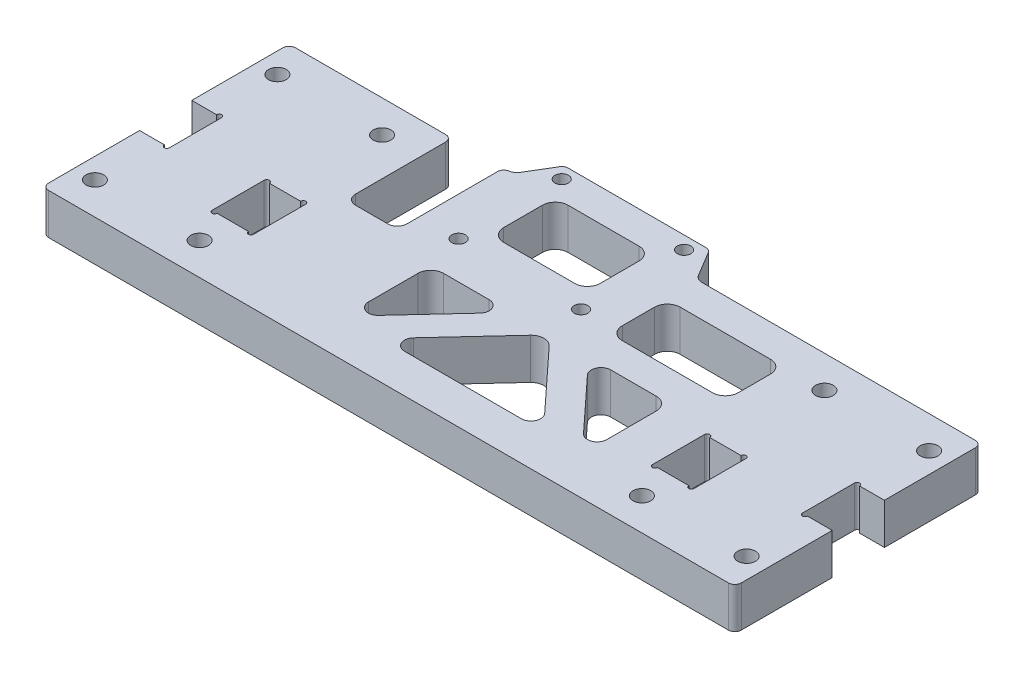
from build123d import *

# Parameters (mm, degrees)
SKETCH1_R           = 2.75
BOSS_EXTRUDE1_DEPTH = 12.7
SKETCH2_W           = 16
SKETCH2_H           = 41.596113018
CUT_EXTRUDE1_DEPTH  = 233.151916856
SKETCH3_R           = 2.1
CUT_EXTRUDE2_DEPTH  = 233.151916856
CUT_EXTRUDE3_DEPTH  = 233.151916856
FILLET1_R           = 3
FILLET2_R           = 2


with BuildPart() as part:
    # Sketch1 → Boss-Extrude1 (new body)
    with BuildSketch(Plane(origin=(0, 0, 0), x_dir=(1, 0, 0), z_dir=(0, 1, 0))):
        with BuildLine():
            Line((0, 0), (215, 0))
            Line((215, 0), (215, 30.225))
            Line((215, 30.225), (207.32, 30.225))
            ThreePointArc((207.32, 30.225), (206.52, 29.425), (205.72, 30.225))
            Line((205.72, 30.225), (205.72, 46.425))
            ThreePointArc((205.72, 46.425), (206.52, 47.225), (207.32, 46.425))
            Line((207.32, 46.425), (215, 46.425))
            Line((215, 46.425), (215, 76.65))
            Line((215, 76.65), (126.5, 76.65))
            Line((126.5, 76.65), (120.5, 86.65))
            Line((120.5, 86.65), (75.5, 86.65))
            Line((75.5, 86.65), (69.5, 76.65))
            Line((69.5, 76.65), (0, 76.65))
            Line((0, 76.65), (0, 46.425))
            Line((0, 46.425), (7.68, 46.425))
            ThreePointArc((7.68, 46.425), (8.48, 47.225), (9.28, 46.425))
            Line((9.28, 46.425), (9.28, 30.225))
            ThreePointArc((9.28, 30.225), (8.48, 29.425), (7.68, 30.225))
            Line((7.68, 30.225), (0, 30.225))
            Line((0, 30.225), (0, 0))
        make_face()
        with Locations((38.85, 66.65)):
            Circle(SKETCH1_R, mode=Mode.SUBTRACT)
        with Locations((38.85, 10)):
            Circle(SKETCH1_R, mode=Mode.SUBTRACT)
        with Locations((176.15, 66.65)):
            Circle(SKETCH1_R, mode=Mode.SUBTRACT)
        with Locations((176.15, 10)):
            Circle(SKETCH1_R, mode=Mode.SUBTRACT)
        with Locations((6.35, 10)):
            Circle(SKETCH1_R, mode=Mode.SUBTRACT)
        with Locations((6.35, 66.65)):
            Circle(SKETCH1_R, mode=Mode.SUBTRACT)
        with Locations((208.65, 66.65)):
            Circle(SKETCH1_R, mode=Mode.SUBTRACT)
        with Locations((208.65, 10)):
            Circle(SKETCH1_R, mode=Mode.SUBTRACT)
        with BuildLine():
            Line((32.7, 36.2), (32.7, 20))
            ThreePointArc((32.7, 20), (33.5, 19.2), (34.3, 20))
            Line((34.3, 20), (44, 20))
            ThreePointArc((44, 20), (44.8, 19.2), (45.6, 20))
            Line((45.6, 20), (45.6, 36.2))
            ThreePointArc((45.6, 36.2), (44.8, 37), (44, 36.2))
            Line((44, 36.2), (34.3, 36.2))
            ThreePointArc((34.3, 36.2), (33.5, 37), (32.7, 36.2))
        make_face(mode=Mode.SUBTRACT)
        with BuildLine():
            Line((182.3, 36.2), (182.3, 20))
            ThreePointArc((182.3, 20), (181.5, 19.2), (180.7, 20))
            Line((180.7, 20), (171, 20))
            ThreePointArc((171, 20), (170.2, 19.2), (169.4, 20))
            Line((169.4, 20), (169.4, 36.2))
            ThreePointArc((169.4, 36.2), (170.2, 37), (171, 36.2))
            Line((171, 36.2), (180.7, 36.2))
            ThreePointArc((180.7, 36.2), (181.5, 37), (182.3, 36.2))
        make_face(mode=Mode.SUBTRACT)
    extrude(amount=BOSS_EXTRUDE1_DEPTH)

    # Sketch2 → Cut-Extrude1 (cut, through all)
    with BuildSketch(Plane(origin=(0, 12.7, 0), x_dir=(1, 0, 0), z_dir=(0, 1, 0))):
        with Locations((58.6, 64.448056509)):
            Rectangle(SKETCH2_W, SKETCH2_H)
    extrude(amount=-CUT_EXTRUDE1_DEPTH, mode=Mode.SUBTRACT)

    # Sketch3 → Cut-Extrude2 (cut, through all)
    with BuildSketch(Plane(origin=(0, 12.7, 0), x_dir=(1, 0, 0), z_dir=(0, 1, 0))):
        with Locations((78.6, 82.65)):
            Circle(SKETCH3_R)
        with Locations((78.6, 50.65)):
            Circle(SKETCH3_R)
        with Locations((116.6, 82.65)):
            Circle(SKETCH3_R)
        with Locations((116.6, 50.65)):
            Circle(SKETCH3_R)
    extrude(amount=-CUT_EXTRUDE2_DEPTH, mode=Mode.SUBTRACT)

    # Sketch5 → Cut-Extrude3 (cut, through all)
    with BuildSketch(Plane(origin=(0, 12.7, 0), x_dir=(1, 0, 0), z_dir=(0, 1, 0))):
        with BuildLine():
            Line((86.801282022, 17.617384584), (101.93497769, 33.961775906))
            ThreePointArc((101.93497769, 33.961775906), (102.482756625, 37.201109428), (99.733695668, 39))
            Line((99.733695668, 39), (85.6, 39))
            ThreePointArc((85.6, 39), (82.771572875, 37.828427125), (81.6, 35))
            Line((81.6, 35), (81.6, 19.655608678))
            ThreePointArc((81.6, 19.655608678), (83.505432977, 16.862416413), (86.801282022, 17.617384584))
        make_face()
        with BuildLine():
            Line((115.664957304, 35.830153888), (98.26502231, 17.038224094))
            ThreePointArc((98.26502231, 17.038224094), (97.717243375, 13.798890572), (100.466304332, 12))
            Line((100.466304332, 12), (136.733695668, 12))
            ThreePointArc((136.733695668, 12), (139.482756625, 13.798890572), (138.93497769, 17.038224094))
            Line((138.93497769, 17.038224094), (121.535042696, 35.830153888))
            ThreePointArc((121.535042696, 35.830153888), (118.6, 37.112521762), (115.664957304, 35.830153888))
        make_face()
        with BuildLine():
            Line((137.466304332, 39), (151.6, 39))
            ThreePointArc((151.6, 39), (154.428427125, 37.828427125), (155.6, 35))
            Line((155.6, 35), (155.6, 19.655608678))
            ThreePointArc((155.6, 19.655608678), (153.694567023, 16.862416413), (150.398717978, 17.617384584))
            Line((150.398717978, 17.617384584), (135.26502231, 33.961775906))
            ThreePointArc((135.26502231, 33.961775906), (134.717243375, 37.201109428), (137.466304332, 39))
        make_face()
        with BuildLine():
            Line((86.6, 76.65), (108.6, 76.65))
            ThreePointArc((108.6, 76.65), (111.428427125, 75.478427125), (112.6, 72.65))
            Line((112.6, 72.65), (112.6, 60.65))
            ThreePointArc((112.6, 60.65), (111.428427125, 57.821572875), (108.6, 56.65))
            Line((108.6, 56.65), (86.6, 56.65))
            ThreePointArc((86.6, 56.65), (83.771572875, 57.821572875), (82.6, 60.65))
            Line((82.6, 60.65), (82.6, 72.65))
            ThreePointArc((82.6, 72.65), (83.771572875, 75.478427125), (86.6, 76.65))
        make_face()
        with BuildLine():
            Line((131.4, 66.65), (159.4, 66.65))
            ThreePointArc((159.4, 66.65), (162.228427125, 65.478427125), (163.4, 62.65))
            Line((163.4, 62.65), (163.4, 52.65))
            ThreePointArc((163.4, 52.65), (162.228427125, 49.821572875), (159.4, 48.65))
            Line((159.4, 48.65), (131.4, 48.65))
            ThreePointArc((131.4, 48.65), (128.571572875, 49.821572875), (127.4, 52.65))
            Line((127.4, 52.65), (127.4, 62.65))
            ThreePointArc((127.4, 62.65), (128.571572875, 65.478427125), (131.4, 66.65))
        make_face()
    extrude(amount=-CUT_EXTRUDE3_DEPTH, mode=Mode.SUBTRACT)

    # Fillet1
    fillet1_edges = [part.edges().sort_by_distance(p)[0] for p in [
        (69.5, 6.35, -76.65),
        (66.6, 6.35, -43.65),
        (50.6, 6.35, -43.65),
        (126.5, 6.35, -76.65),
    ]]
    fillet(fillet1_edges, radius=FILLET1_R)

    # Fillet2
    fillet2_edges = [part.edges().sort_by_distance(p)[0] for p in [
        (0, 6.35, 0),
        (215, 6.35, 0),
        (215, 6.35, -76.65),
        (120.5, 6.35, -86.65),
        (75.5, 6.35, -86.65),
        (50.6, 6.35, -76.65),
        (66.6, 6.35, -76.65),
        (0, 6.35, -76.65),
    ]]
    fillet(fillet2_edges, radius=FILLET2_R)


solid = part.part
